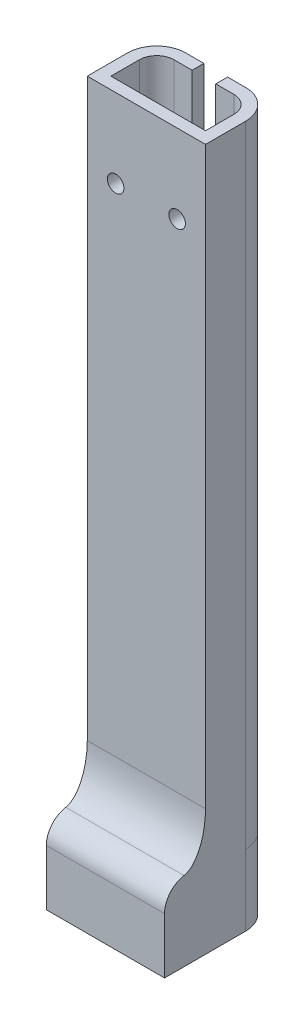
from build123d import *

# Parameters (mm, degrees)
BOSS_EXTRUDE1_DEPTH = 80
FILLET1_R           = 3.7
CUT_EXTRUDE1_DEPTH  = 26
SKETCH4_R           = 1.0499999999999892
SKETCH4_R_2         = 1.0499999999999914
CUT_EXTRUDE2_DEPTH  = 1.5
CUT_EXTRUDE3_DEPTH  = 54
FILLET2_R           = 1
SKETCH6_W           = 15
SKETCH6_H           = 14.000000000000002
BOSS_EXTRUDE2_DEPTH = 9
FILLET3_R           = 3.7
CUT_EXTRUDE4_DEPTH  = 9
SKETCH9_W           = 3
SKETCH9_H           = 3
CUT_EXTRUDE6_DEPTH  = 90.82989480122973
SKETCH10_W          = 15
SKETCH10_H          = 5.200000000000001
BOSS_EXTRUDE3_DEPTH = 1
FILLET8_SIZE        = 6
FILLET8_SIZE_2      = 3
FILLET9_R           = 3
BOSS_EXTRUDE5_START = -3.7
BOSS_EXTRUDE5_DEPTH = 3.7
CUT_EXTRUDE7_DEPTH  = 6.4
CUT_EXTRUDE8_REACH  = 83.561


with BuildPart() as part:
    # Sketch1 → Boss-Extrude1 (new body)
    with BuildSketch(Plane(origin=(0, 0, 0), x_dir=(1, 0, 0), z_dir=(0, 1, 0))):
        Polygon((-7.499999999999999, 4.4), (7.500000000000001, 4.4), (7.500000000000003, -4.4), (-7.499999999999998, -4.4), align=None)
    extrude(amount=BOSS_EXTRUDE1_DEPTH)

    # Fillet1
    fillet1_edges = [part.edges().sort_by_distance(p)[0] for p in [
        (-7.499999999999999, 40, -4.4),
        (7.500000000000001, 40, -4.4),
    ]]
    fillet(fillet1_edges, radius=FILLET1_R)

    # Sketch3 → Cut-Extrude1 (cut)
    with BuildSketch(Plane(origin=(0, 80, 0), x_dir=(1, 0, 0), z_dir=(0, 1, 0))):
        with BuildLine():
            Line((-5.999999999999998, 0.6999999999999998), (-5.999999999999997, -2.9000000000000004))
            Line((-5.999999999999997, -2.9000000000000004), (6.000000000000002, -2.9000000000000004))
            Line((6.000000000000002, -2.9000000000000004), (6.000000000000001, 0.700000000000001))
            ThreePointArc((6.000000000000001, 0.700000000000001), (5.355634918610405, 2.255634918610405), (3.8000000000000007, 2.900000000000001))
            Line((3.8000000000000007, 2.900000000000001), (-3.7999999999999985, 2.9000000000000004))
            ThreePointArc((-3.7999999999999985, 2.9000000000000004), (-5.355634918610402, 2.2556349186104048), (-5.999999999999998, 0.6999999999999998))
        make_face()
    extrude(amount=-CUT_EXTRUDE1_DEPTH, mode=Mode.SUBTRACT)

    # Sketch4 → Cut-Extrude2 (cut)
    with BuildSketch(Plane.XY.offset(4.4)):
        with Locations((-3.899999999999998, 70)):
            Circle(SKETCH4_R)
        with Locations((3.9000000000000026, 70)):
            Circle(SKETCH4_R_2)
    extrude(amount=-CUT_EXTRUDE2_DEPTH, mode=Mode.SUBTRACT)

    # Sketch5 → Cut-Extrude3 (cut)
    with BuildSketch(Plane(origin=(0, 54.00000000000001, 0), x_dir=(1, 0, 0), z_dir=(0, 1, 0))):
        Polygon((-2.9999999999999996, 1.7000000000000008), (3.0000000000000004, 1.7000000000000008), (3.0000000000000004, -1.2999999999999994), (-2.999999999999999, -1.2999999999999994), align=None)
    extrude(amount=-CUT_EXTRUDE3_DEPTH, mode=Mode.SUBTRACT)

    # Fillet2
    fillet2_edges = [part.edges().sort_by_distance(p)[0] for p in [
        (3.0000000000000004, 27.000000000000007, -1.7000000000000008),
        (3.0000000000000004, 27.000000000000007, 1.2999999999999994),
        (-2.999999999999999, 27.000000000000007, 1.2999999999999994),
        (-2.9999999999999996, 27.000000000000007, -1.7000000000000008),
    ]]
    fillet(fillet2_edges, radius=FILLET2_R)

    # Sketch6 → Boss-Extrude2 (add)
    with BuildSketch(Plane.XZ):
        with Locations((1.78e-15, 2.6000000000000005)):
            Rectangle(SKETCH6_W, SKETCH6_H)
    extrude(amount=BOSS_EXTRUDE2_DEPTH)

    # Fillet3
    fillet3_edges = [part.edges().sort_by_distance(p)[0] for p in [
        (7.500000000000002, -4.5, -4.4),
        (-7.499999999999998, -4.5, -4.4),
    ]]
    fillet(fillet3_edges, radius=FILLET3_R)

    # Sketch7 → Cut-Extrude4 (cut)
    with BuildSketch(Plane.XZ.offset(9)):
        with BuildLine():
            Line((-3.799999999999998, -2.6000000000000005), (3.8000000000000007, -2.6000000000000005))
            ThreePointArc((3.8000000000000007, -2.6000000000000005), (5.143502884254442, -2.0435028842544405), (5.700000000000002, -0.6999999999999998))
            Line((5.700000000000002, -0.6999999999999998), (5.700000000000002, 7.800000000000002))
            Line((5.700000000000002, 7.800000000000002), (-5.699999999999998, 7.800000000000002))
            Line((-5.699999999999998, 7.800000000000002), (-5.699999999999998, -0.6999999999999998))
            ThreePointArc((-5.699999999999998, -0.6999999999999998), (-5.143502884254438, -2.0435028842544405), (-3.799999999999998, -2.6000000000000005))
        make_face()
    extrude(amount=-CUT_EXTRUDE4_DEPTH, mode=Mode.SUBTRACT)

    # Sketch9 → Cut-Extrude6 (cut, through all)
    with BuildSketch(Plane(origin=(0, 80, 0), x_dir=(1, 0, 0), z_dir=(0, 1, 0))):
        with Locations((0, 2.9000000000000012)):
            Rectangle(SKETCH9_W, SKETCH9_H)
    extrude(amount=-CUT_EXTRUDE6_DEPTH, mode=Mode.SUBTRACT)

    # Sketch10 → Boss-Extrude3 (add)
    with BuildSketch(Plane(origin=(0, 0, 0), x_dir=(1, 0, 0), z_dir=(0, 1, 0))):
        with Locations((1.78e-15, -7.000000000000001)):
            Rectangle(SKETCH10_W, SKETCH10_H)
    extrude(amount=BOSS_EXTRUDE3_DEPTH)

    # Fillet8
    # an asymmetric fillet: 6, 3 mm, written as the material it adds along each edge
    with BuildSketch(Plane(origin=(-7.499999999999998, 1, 4.4), x_dir=(0, 1, 0), z_dir=(1, 0, 0))) as fillet8_piece_1:
        with BuildLine():
            Bezier((FILLET8_SIZE, 0), (8.9e-16, 0), (0, FILLET8_SIZE_2), weights=[1, 0.7071067811865476, 1])
            Line((0, FILLET8_SIZE_2), (0, 0))
            Line((0, 0), (FILLET8_SIZE, 0))
        make_face()
    extrude(amount=15)

    # Fillet9
    fillet9_edges = [part.edges().sort_by_distance(p)[0] for p in [
        (1.78e-15, 1, 9.600000000000001),
    ]]
    fillet(fillet9_edges, radius=FILLET9_R)

    # Sketch11 → Boss-Extrude5 (add)
    with BuildSketch(Plane(origin=(0, 0, -4.4), x_dir=(-1, 0, 0), z_dir=(0, 0, -1)).offset(BOSS_EXTRUDE5_START)):
        Polygon((3.799999999999998, 45), (7.5, 45), (7.499999999999999, 33), (3.8000000000000003, 33), align=None)
    extrude(amount=BOSS_EXTRUDE5_DEPTH)

    # Sketch12 → Cut-Extrude7 (cut)
    with BuildSketch(Plane(origin=(0, 0, -4.4), x_dir=(-1, 0, 0), z_dir=(0, 0, -1))):
        Polygon((7.499999999999999, 42.2), (3.299999999999998, 42.2), (3.299999999999999, 35.8), (7.5, 35.8), align=None)
    extrude(amount=-CUT_EXTRUDE7_DEPTH, mode=Mode.SUBTRACT)

    # Cut-Extrude8: up to this face of the body (flat: up to its plane)
    cut_extrude8_end = Plane(part.part.faces().sort_by_distance((-5.4, 39, 2))[0])
    # Sketch13 → Cut-Extrude8 (cut, up to the picked face)
    with BuildSketch(Plane(origin=(0, 0, -4.4), x_dir=(-1, 0, 0), z_dir=(0, 0, -1)), mode=Mode.PRIVATE) as cut_extrude8_sk1:
        Polygon((1.5, 44.2), (5.5, 44.2), (5.500000000000001, 41.2), (1.5000000000000004, 41.2), (-1.5, 41.2), (-1.5, 44.2), align=None)
    cut_extrude8_tool1 = split(extrude(cut_extrude8_sk1.sketch, amount=-CUT_EXTRUDE8_REACH, mode=Mode.PRIVATE), bisect_by=cut_extrude8_end, keep=Keep.BOTH, mode=Mode.PRIVATE)
    add(cut_extrude8_tool1.solids().sort_by(Axis((-2, 42.7, -4.4), (0, 0, 1)))[0], mode=Mode.SUBTRACT)


solid = part.part
